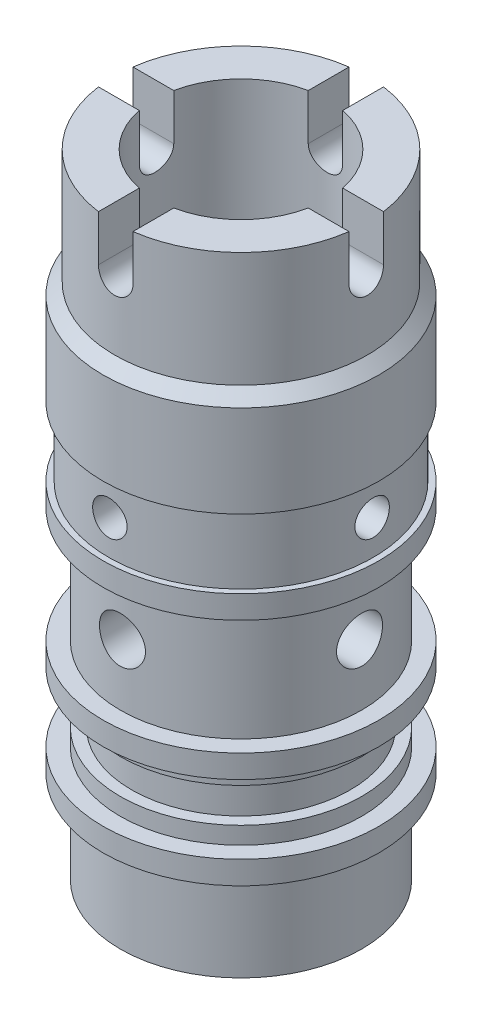
from build123d import *

# Parameters (mm, degrees)
SKETCH2_W               = 10.5
SKETCH2_H               = 8
SKETCH2_H_2             = 6
SKETCH2_H_3             = 10
SKETCH2_W_2             = 11.5
SKETCH2_W_3             = 11
CUT_EXTRUDE1_DEPTH      = 33.314857264
CUT_EXTRUDE1_DEPTH_BACK = 33.314857264
SKETCH4_R               = 7.5
CUT_EXTRUDE4_DEPTH      = 33.314857264
CIRPATTERN1_COUNT       = 4
CUT_EXTRUDE5_START      = -10
SKETCH8_R               = 1.5
CUT_EXTRUDE5_DEPTH      = 43.314857349
CIRPATTERN2_COUNT       = 4
CUT_EXTRUDE6_START      = -10
SKETCH15_R              = 2
CUT_EXTRUDE6_DEPTH      = 43.314857349
CIRPATTERN3_COUNT       = 4
SKETCH14_W              = 1
SKETCH14_H              = 3
SKETCH24_W              = 7.012256347
SKETCH24_H              = 3
CHAMFER1_SIZE           = 1


with BuildPart() as part:
    # Sketch2 → Revolve1 (revolve)
    with BuildSketch(Plane.XY, mode=Mode.PRIVATE) as revolve1_sk:
        with Locations((5.25, -23.5)):
            Rectangle(SKETCH2_W, SKETCH2_H)
        Polygon((10.5, -17.5), (0, -17.5), (0, -19.5), (10.5, -19.5), (12, -19.5), (12, -17.5), align=None)
        with Locations((5.25, -14.5)):
            Rectangle(SKETCH2_W, SKETCH2_H_2)
        Polygon((10.5, -9.5), (0, -9.5), (0, -11.5), (10.5, -11.5), (12, -11.5), (12, -9.5), align=None)
        with Locations((5.25, -4.5)):
            Rectangle(SKETCH2_W, SKETCH2_H_3)
        Polygon((11.5, 2.5), (0, 2.5), (0, 0.5), (10.5, 0.5), (12, 0.5), (12, 2.5), align=None)
        with Locations((5.75, 5.5)):
            Rectangle(SKETCH2_W_2, SKETCH2_H_2)
        Polygon((11, 17.5), (0, 17.5), (0, 8.5), (11.5, 8.5), (12, 8.5), (12, 17.5), align=None)
        with Locations((5.5, 22.5)):
            Rectangle(SKETCH2_W_3, SKETCH2_H_3)
    revolve(revolve1_sk.sketch.rotate(Axis((0, 27.5, 0), (0, -1, 0)), 180), axis=Axis((0, 27.5, 0), (0, -1, 0)))

    # Sketch4 → Cut-Extrude1 (cut, two sides: drawn at the far end of the back side and taken through both)
    with BuildSketch(Plane(origin=(0, 0, 0), x_dir=(1, 0, 0), z_dir=(0, 1, 0)).offset(-CUT_EXTRUDE1_DEPTH_BACK)):
        with Locations(Location((0, 0, 0), (0, 0, 270))):
            Circle(SKETCH4_R)
    extrude(amount=CUT_EXTRUDE1_DEPTH + CUT_EXTRUDE1_DEPTH_BACK, mode=Mode.SUBTRACT)

    # Sketch13 → Cut-Extrude4 (cut, symmetric)
    with BuildSketch(Plane.XY):
        with BuildLine():
            Line((1.5, 150.765175584), (1.5, 27.5))
            Line((1.5, 27.5), (1.5, 23.5))
            ThreePointArc((1.5, 23.5), (0, 22), (-1.5, 23.5))
            Line((-1.5, 23.5), (-1.5, 27.5))
            Line((-1.5, 27.5), (-1.5, 150.765175584))
            Line((-1.5, 150.765175584), (-1.5, 397.295526751))
            Line((-1.5, 397.295526751), (1.5, 397.295526751))
            Line((1.5, 397.295526751), (1.5, 150.765175584))
        make_face()
    cut_extrude4 = extrude(amount=CUT_EXTRUDE4_DEPTH, both=True, mode=Mode.SUBTRACT)

    # CirPattern1: Cut-Extrude4 ×4 about axis
    cirpattern1_axis = Axis((0, 27.5, 0), (0, -1, 0))
    for i in range(1, CIRPATTERN1_COUNT):
        add(cut_extrude4.rotate(cirpattern1_axis, i * 360 / CIRPATTERN1_COUNT), mode=Mode.SUBTRACT)

    # Sketch8 → Cut-Extrude5 (cut)
    with BuildSketch(Plane.XY.offset(CUT_EXTRUDE5_START)):
        with Locations(Location((0, 5.5, 0), (0, 0, 180))):
            Circle(SKETCH8_R)
    cut_extrude5 = extrude(amount=CUT_EXTRUDE5_DEPTH, mode=Mode.SUBTRACT)

    # CirPattern2: Cut-Extrude5 ×4 about axis
    cirpattern2_axis = Axis((0, 27.5, 0), (0, -1, 0))
    for i in range(1, CIRPATTERN2_COUNT):
        add(cut_extrude5.rotate(cirpattern2_axis, i * 360 / CIRPATTERN2_COUNT), mode=Mode.SUBTRACT)

    # Sketch15 → Cut-Extrude6 (cut)
    with BuildSketch(Plane.XY.offset(CUT_EXTRUDE6_START)):
        with Locations(Location((0, -4.192652304, 0), (0, 0, 180))):
            Circle(SKETCH15_R)
    cut_extrude6 = extrude(amount=CUT_EXTRUDE6_DEPTH, mode=Mode.SUBTRACT)

    # CirPattern3: Cut-Extrude6 ×4 about axis
    cirpattern3_axis = Axis((0, 27.5, 0), (0, -1, 0))
    for i in range(1, CIRPATTERN3_COUNT):
        add(cut_extrude6.rotate(cirpattern3_axis, i * 360 / CIRPATTERN3_COUNT), mode=Mode.SUBTRACT)

    # Sketch14 → Cut-Revolve2 (revolve, cut)
    with BuildSketch(Plane.XY):
        with Locations((-10.01319556, -14.5)):
            Rectangle(SKETCH14_W, SKETCH14_H)
    revolve(axis=Axis((0, 27.5, 0), (0, -1, 0)), mode=Mode.SUBTRACT)

    # Sketch24 → Cut-Revolve5 (revolve, cut)
    with BuildSketch(Plane.XY, mode=Mode.PRIVATE) as cut_revolve5_sk:
        with Locations((-5.493871827, 14)):
            Rectangle(SKETCH24_W, SKETCH24_H)
    revolve(cut_revolve5_sk.sketch.rotate(Axis((0, 28.772308455, 0), (0, -1, 0)), 281.536959033), axis=Axis((0, 28.772308455, 0), (0, -1, 0)), mode=Mode.SUBTRACT)

    # Chamfer1
    chamfer1_edges = [part.edges().sort_by_distance(p)[0] for p in [
        (12, 17.5, 0),
    ]]
    chamfer(chamfer1_edges, length=CHAMFER1_SIZE - 0.0001)  # a hair under: the kernel refuses the full size


solid = part.part
